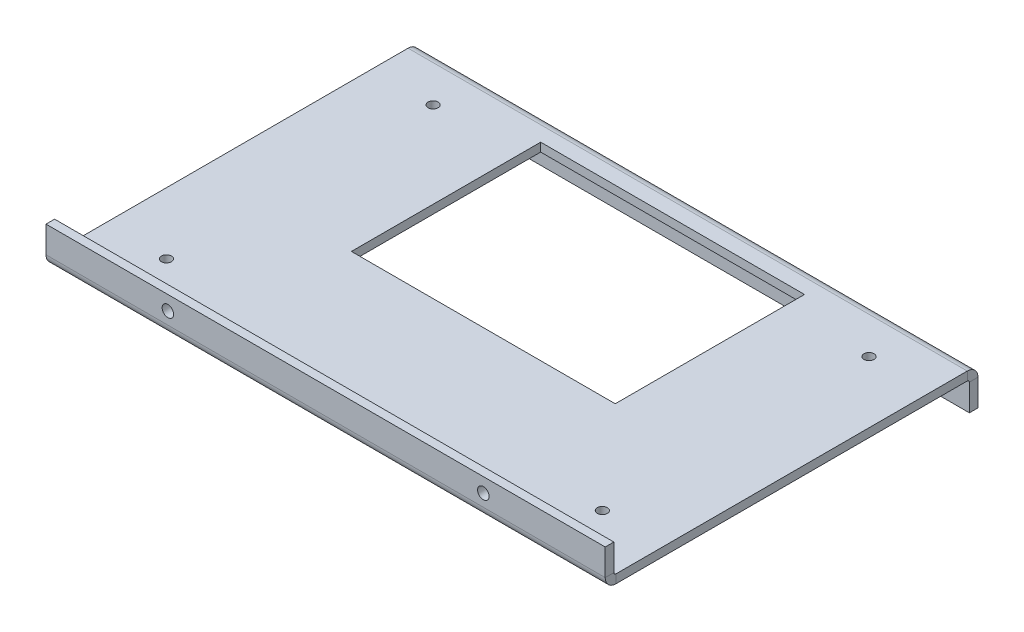
from build123d import *

# Parameters (mm, degrees)
SKETCH_1_W                       = 195
SKETCH_1_H                       = 130
SM_BASE_FLANGE_1_DEPTH           = 3
SM_EDGE_FLANGE_1_STRIP_W         = 13.4732
SM_EDGE_FLANGE_1_STRIP_H         = 3
SM_EDGE_FLANGE_1_STRIP_CUT_DEPTH = 195
SM_EDGE_FLANGE_1_DEPTH           = 195
SM_EDGE_FLANGE_2_STRIP_W         = 13.4732
SM_EDGE_FLANGE_2_STRIP_H         = 3
SM_EDGE_FLANGE_2_STRIP_CUT_DEPTH = 195
SM_EDGE_FLANGE_2_DEPTH           = 195
SKETCH_12_R                      = 2
CUT_EXTRUDE_1_DEPTH              = 10
SKETCH_13_R                      = 2
CUT_EXTRUDE_2_DEPTH              = 10
CUT_EXTRUDE_3_REACH              = 119.899
SKETCH_14_R                      = 1.75
SKETCH_14_W                      = 92
SKETCH_14_H                      = 66


# Sheet-metal steps are written as plain solids
with BuildPart() as part:
    # Sketch 1 → 基体-法兰1 (new body)
    with BuildSketch(Plane(origin=(0, 0, 0), x_dir=(1, 0, 0), z_dir=(0, 1, 0))):
        Rectangle(SKETCH_1_W, SKETCH_1_H)
    extrude(amount=-SM_BASE_FLANGE_1_DEPTH)

    # 边线-法兰1 strip (across the edge) → 边线-法兰1 strip cut (cut)
    with BuildSketch(Plane(origin=(-97.5, 0, 65), x_dir=(0, 0, -1), z_dir=(1, 0, 0))):
        with Locations((-3, -1.5)):
            Rectangle(SM_EDGE_FLANGE_1_STRIP_W, SM_EDGE_FLANGE_1_STRIP_H)
    extrude(amount=SM_EDGE_FLANGE_1_STRIP_CUT_DEPTH, mode=Mode.SUBTRACT)

    # 边线-法兰1 section (across the edge) → 边线-法兰1 (add)
    with BuildSketch(Plane(origin=(-97.5, 0, 65), x_dir=(0, 0, -1), z_dir=(1, 0, 0))):
        with BuildLine():
            Line((0, 0.7366), (0, 10))
            Line((0, 10), (3, 10))
            Line((3, 10), (3, 0.7366))
            ThreePointArc((3, 0.7366), (3.215745145, 0.215745145), (3.7366, 0))
            Line((3.7366, 0), (3.7366, -3))
            ThreePointArc((3.7366, -3), (1.094424801, -1.905575199), (0, 0.7366))
        make_face()
    extrude(amount=SM_EDGE_FLANGE_1_DEPTH)

    # 边线-法兰2 strip (across the edge) → 边线-法兰2 strip cut (cut)
    with BuildSketch(Plane(origin=(-97.5, -3, -65), x_dir=(0, 0, 1), z_dir=(1, 0, 0))):
        with Locations((-3, -1.5)):
            Rectangle(SM_EDGE_FLANGE_2_STRIP_W, SM_EDGE_FLANGE_2_STRIP_H)
    extrude(amount=SM_EDGE_FLANGE_2_STRIP_CUT_DEPTH, mode=Mode.SUBTRACT)

    # 边线-法兰2 section (across the edge) → 边线-法兰2 (add)
    with BuildSketch(Plane(origin=(-97.5, -3, -65), x_dir=(0, 0, 1), z_dir=(1, 0, 0))):
        with BuildLine():
            Line((0, 0.7366), (0, 10))
            Line((0, 10), (3, 10))
            Line((3, 10), (3, 0.7366))
            ThreePointArc((3, 0.7366), (3.215745145, 0.215745145), (3.7366, 0))
            Line((3.7366, 0), (3.7366, -3))
            ThreePointArc((3.7366, -3), (1.094424801, -1.905575199), (0, 0.7366))
        make_face()
    extrude(amount=SM_EDGE_FLANGE_2_DEPTH)

    # 草图12 → 切除-拉伸1 (cut)
    with BuildSketch(Plane.XY.offset(65)):
        with Locations((-55, 5)):
            Circle(SKETCH_12_R)
        with Locations(Location((55, 5, 0), (0, 0, 180))):
            Circle(SKETCH_12_R)
    extrude(amount=-CUT_EXTRUDE_1_DEPTH, mode=Mode.SUBTRACT)

    # 草图13 → 切除-拉伸2 (cut)
    with BuildSketch(Plane(origin=(0, 0, -65), x_dir=(-1, 0, 0), z_dir=(0, 0, -1))):
        with Locations(Location((-55, -8, 0), (0, 0, 90))):
            Circle(SKETCH_13_R)
        with Locations(Location((55, -8, 0), (0, 0, 270))):
            Circle(SKETCH_13_R)
    extrude(amount=-CUT_EXTRUDE_2_DEPTH, mode=Mode.SUBTRACT)

    # 草图14 → 切除-拉伸3 (cut, up to next)
    with BuildSketch(Plane(origin=(0, 0, 0), x_dir=(1, 0, 0), z_dir=(0, 1, 0)), mode=Mode.PRIVATE) as cut_extrude_3_sk1:
        with Locations(Location((-76, 48.5, 0), (0, 0, 270))):
            Circle(SKETCH_14_R)
    cut_extrude_3_tool1 = extrude(cut_extrude_3_sk1.sketch, amount=-CUT_EXTRUDE_3_REACH, mode=Mode.PRIVATE) & part.part
    # 草图14 → 切除-拉伸3 (cut, up to next)
    with BuildSketch(Plane(origin=(0, 0, 0), x_dir=(1, 0, 0), z_dir=(0, 1, 0)), mode=Mode.PRIVATE) as cut_extrude_3_sk2:
        with Locations(Location((76, 48.5, 0), (0, 0, 90))):
            Circle(SKETCH_14_R)
    cut_extrude_3_tool2 = extrude(cut_extrude_3_sk2.sketch, amount=-CUT_EXTRUDE_3_REACH, mode=Mode.PRIVATE) & part.part
    # 草图14 → 切除-拉伸3 (cut, up to next)
    with BuildSketch(Plane(origin=(0, 0, 0), x_dir=(1, 0, 0), z_dir=(0, 1, 0)), mode=Mode.PRIVATE) as cut_extrude_3_sk3:
        with Locations(Location((76, -44.5, 0), (0, 0, 270))):
            Circle(SKETCH_14_R)
    cut_extrude_3_tool3 = extrude(cut_extrude_3_sk3.sketch, amount=-CUT_EXTRUDE_3_REACH, mode=Mode.PRIVATE) & part.part
    # 草图14 → 切除-拉伸3 (cut, up to next)
    with BuildSketch(Plane(origin=(0, 0, 0), x_dir=(1, 0, 0), z_dir=(0, 1, 0)), mode=Mode.PRIVATE) as cut_extrude_3_sk4:
        with Locations(Location((-76, -44.5, 0), (0, 0, 90))):
            Circle(SKETCH_14_R)
    cut_extrude_3_tool4 = extrude(cut_extrude_3_sk4.sketch, amount=-CUT_EXTRUDE_3_REACH, mode=Mode.PRIVATE) & part.part
    # 草图14 → 切除-拉伸3 (cut, up to next)
    with BuildSketch(Plane(origin=(0, 0, 0), x_dir=(1, 0, 0), z_dir=(0, 1, 0)), mode=Mode.PRIVATE) as cut_extrude_3_sk5:
        with Locations((0, 23)):
            Rectangle(SKETCH_14_W, SKETCH_14_H)
    cut_extrude_3_tool5 = extrude(cut_extrude_3_sk5.sketch, amount=-CUT_EXTRUDE_3_REACH, mode=Mode.PRIVATE) & part.part
    add(cut_extrude_3_tool1.solids().sort_by_distance((-76, 0, -48.5))[0], mode=Mode.SUBTRACT)
    add(cut_extrude_3_tool2.solids().sort_by_distance((76, 0, -48.5))[0], mode=Mode.SUBTRACT)
    add(cut_extrude_3_tool3.solids().sort_by_distance((76, 0, 44.5))[0], mode=Mode.SUBTRACT)
    add(cut_extrude_3_tool4.solids().sort_by_distance((-76, 0, 44.5))[0], mode=Mode.SUBTRACT)
    add(cut_extrude_3_tool5.solids().sort_by_distance((0, 0, -23))[0], mode=Mode.SUBTRACT)


solid = part.part
